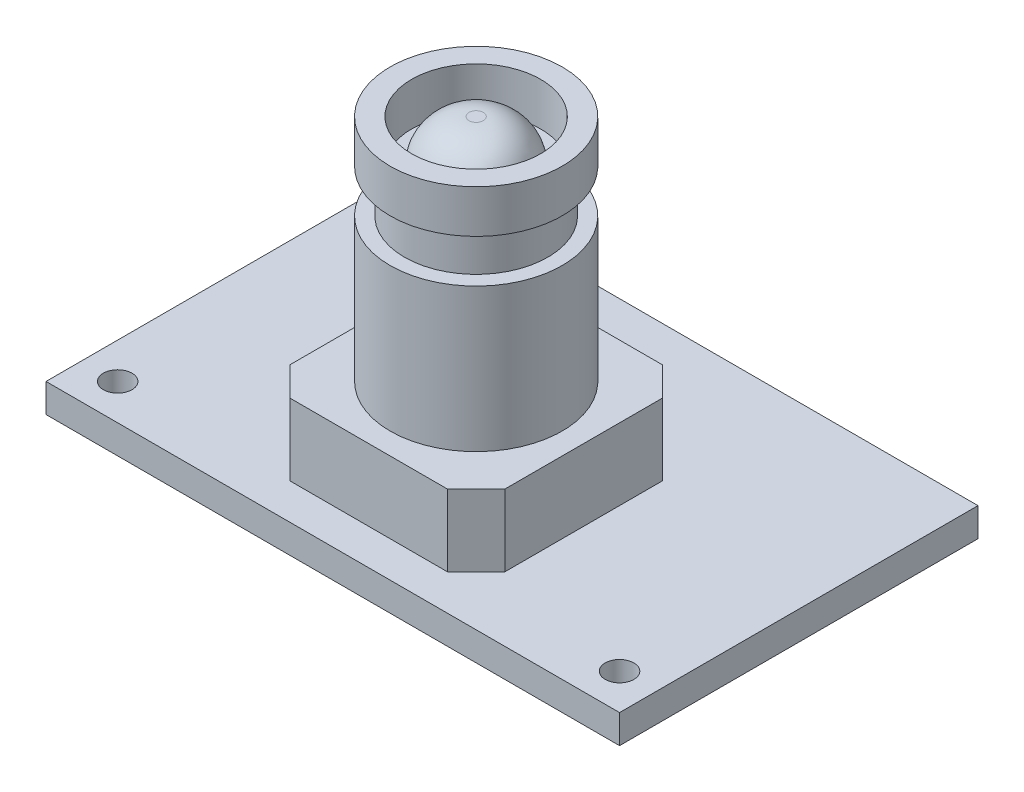
from build123d import *

# Parameters (mm, degrees)
ESQUISSE1_W      = 40
ESQUISSE1_H      = 25
ESQUISSE1_R      = 1
EXTRUSION1_DEPTH = 2
EXTRUSION2_DEPTH = 5
ESQUISSE3_R      = 6
EXTRUSION3_DEPTH = 10
ESQUISSE4_R      = 5
EXTRUSION4_DEPTH = 3
ESQUISSE5_R      = 6
ESQUISSE5_R_2    = 4.5
EXTRUSION5_DEPTH = 3
ESQUISSE6_R      = 3.5
EXTRUSION6_DEPTH = 3
CONG_1_R         = 3


with BuildPart() as part:
    # Esquisse1 → Extrusion1 (new body)
    with BuildSketch(Plane(origin=(0, 0, 0), x_dir=(1, 0, 0), z_dir=(0, 1, 0))):
        with Locations((20, 12.5)):
            Rectangle(ESQUISSE1_W, ESQUISSE1_H)
        with Locations(Location((2.5, 2.5, 0), (0, 0, 270))):
            Circle(ESQUISSE1_R, mode=Mode.SUBTRACT)
        with Locations(Location((37.5, 2.5, 0), (0, 0, 90))):
            Circle(ESQUISSE1_R, mode=Mode.SUBTRACT)
    extrude(amount=EXTRUSION1_DEPTH)

    # Esquisse2 → Extrusion2 (add)
    with BuildSketch(Plane(origin=(0, 2, 0), x_dir=(-1, 0, 0), z_dir=(0, 1, 0))):
        Polygon((-14.5, -17.5), (-25.5, -17.5), (-27.5, -15.5), (-27.5, -4.5), (-25.5, -2.5), (-14.5, -2.5), (-12.5, -4.5), (-12.5, -15.5), align=None)
    extrude(amount=EXTRUSION2_DEPTH)

    # Esquisse3 → Extrusion3 (add)
    with BuildSketch(Plane(origin=(0, 7, 0), x_dir=(1, 0, 0), z_dir=(0, 1, 0))):
        with Locations(Location((20, 10, 0), (0, 0, 90))):
            Circle(ESQUISSE3_R)
    extrude(amount=EXTRUSION3_DEPTH)

    # Esquisse4 → Extrusion4 (add)
    with BuildSketch(Plane(origin=(0, 17, 0), x_dir=(1, 0, 0), z_dir=(0, 1, 0))):
        with Locations(Location((20, 10, 0), (0, 0, 270))):
            Circle(ESQUISSE4_R)
    extrude(amount=EXTRUSION4_DEPTH)

    # Esquisse5 → Extrusion5 (add)
    with BuildSketch(Plane(origin=(0, 20, 0), x_dir=(1, 0, 0), z_dir=(0, 1, 0))):
        with Locations(Location((20, 10, 0), (0, 0, 90))):
            Circle(ESQUISSE5_R)
        with Locations(Location((20, 10, 0), (0, 0, 270))):
            Circle(ESQUISSE5_R_2, mode=Mode.SUBTRACT)
    extrude(amount=EXTRUSION5_DEPTH)

    # Esquisse6 → Extrusion6 (add)
    with BuildSketch(Plane(origin=(0, 20, 0), x_dir=(1, 0, 0), z_dir=(0, 1, 0))):
        with Locations(Location((20, 10, 0), (0, 0, 270))):
            Circle(ESQUISSE6_R)
    extrude(amount=EXTRUSION6_DEPTH)

    # Congé1
    cong_1_edges = [part.edges().sort_by_distance(p)[0] for p in [
        (20, 23, -13.5),
    ]]
    fillet(cong_1_edges, radius=CONG_1_R - 0.0001)  # a hair under: the kernel refuses the full size


solid = part.part
